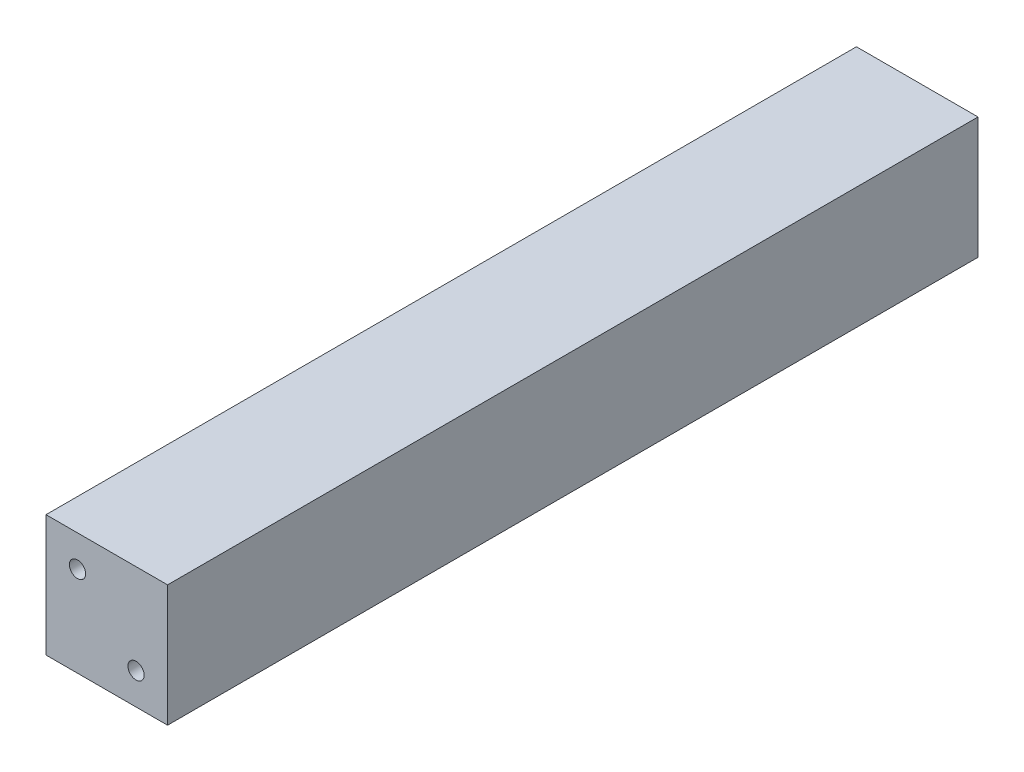
from build123d import *

# Parameters (mm, degrees)
CROQUIS1_W              = 30
CROQUIS1_H              = 30
SALIENTE_EXTRUIR1_DEPTH = 200
CROQUIS2_R              = 2
CORTAR_EXTRUIR1_DEPTH   = 25
CROQUIS4_R              = 2
CORTAR_EXTRUIR3_DEPTH   = 25


with BuildPart() as part:
    # Croquis1 → Saliente-Extruir1 (new body)
    with BuildSketch(Plane.XY):
        Rectangle(CROQUIS1_W, CROQUIS1_H)
    extrude(amount=SALIENTE_EXTRUIR1_DEPTH)

    # Croquis2 → Cortar-Extruir1 (cut)
    with BuildSketch(Plane.XY.offset(200)):
        with Locations((-7.221825407, 7.221825407)):
            Circle(CROQUIS2_R)
        with Locations((7.221825407, -7.221825407)):
            Circle(CROQUIS2_R)
    extrude(amount=-CORTAR_EXTRUIR1_DEPTH, mode=Mode.SUBTRACT)

    # Croquis4 → Cortar-Extruir3 (cut)
    with BuildSketch(Plane(origin=(0, 0, 0), x_dir=(-1, 0, 0), z_dir=(0, 0, -1))):
        Circle(CROQUIS4_R)
    extrude(amount=-CORTAR_EXTRUIR3_DEPTH, mode=Mode.SUBTRACT)


solid = part.part
